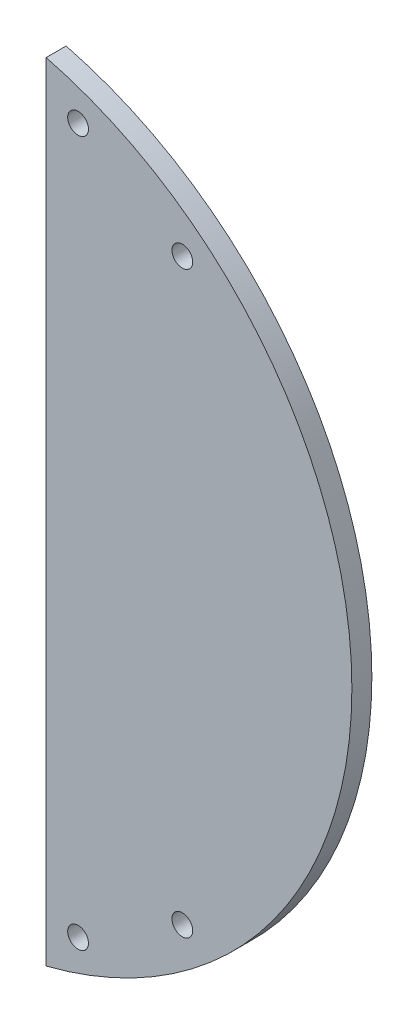
from build123d import *

# Parameters (mm, degrees)
SKETCH1_R           = 1.65
BOSS_EXTRUDE1_DEPTH = 3.175


with BuildPart() as part:
    # Sketch1 → Boss-Extrude1 (new body)
    with BuildSketch(Plane(origin=(0, 0, 0), x_dir=(-1, 0, 0), z_dir=(0, 0, 1))):
        with BuildLine():
            Line((0, -62.136729163), (0, 62.869580678))
            ThreePointArc((0, 62.869580678), (-48.575, 0.366425758), (0, -62.136729163))
        make_face()
        with Locations((-5.075, 56.366425758)):
            Circle(SKETCH1_R, mode=Mode.SUBTRACT)
        with Locations((-21.638471196, 46.366425758)):
            Circle(SKETCH1_R, mode=Mode.SUBTRACT)
        with Locations((-5.075, -55.633574242)):
            Circle(SKETCH1_R, mode=Mode.SUBTRACT)
        with Locations((-21.638471196, -45.633574242)):
            Circle(SKETCH1_R, mode=Mode.SUBTRACT)
    extrude(amount=BOSS_EXTRUDE1_DEPTH)


solid = part.part
